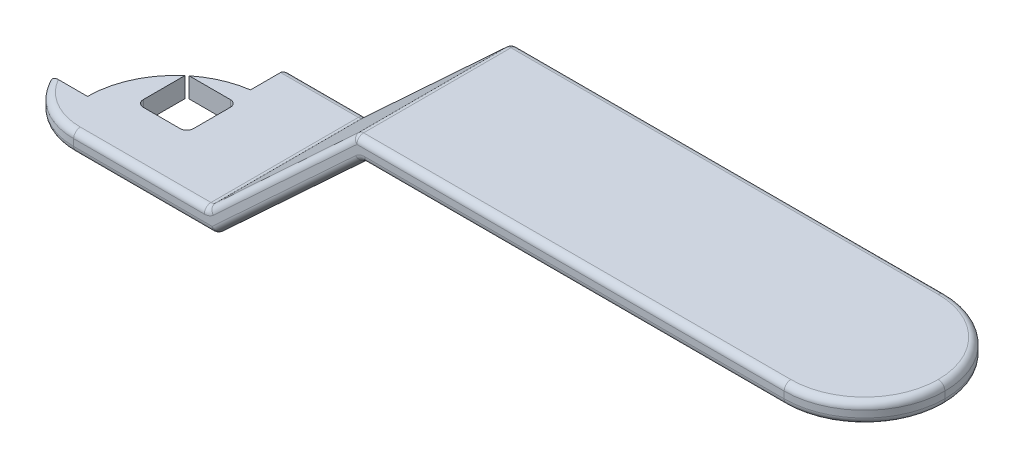
from build123d import *

# Parameters (mm, degrees)
EXTRUDE_THIN1_DEPTH = 24
CUT_EXTRUDE1_DEPTH  = 131.847239176
FILLET1_R           = 10
FILLET2_R           = 12
FILLET3_R           = 1
FILLET4_R           = 1


# Some blends are built 0.0001 mm under size
with BuildPart() as part:
    # Sketch1 → Extrude-Thin1 (new body)
    with BuildSketch(Plane.XY):
        Polygon((0, 0), (30, 0), (52, 20.396078054), (127, 20.396078054), (127, 23.396078054), (50.823303189, 23.396078054), (28.823303189, 3), (0, 3), align=None)
    extrude(amount=-EXTRUDE_THIN1_DEPTH)

    # Sketch2 → Cut-Extrude1 (cut, through all)
    with BuildSketch(Plane(origin=(0, 3, 0), x_dir=(1, 0, 0), z_dir=(0, 1, 0))):
        with BuildLine():
            Line((16.823303189, 24), (0, 24))
            Line((0, 24), (0, 5.5))
            Line((0, 5.5), (5.5, 5.5))
            ThreePointArc((5.5, 5.5), (6.698004209, 10.97816866), (10.073303189, 15.456215417))
            Line((10.073303189, 15.456215417), (10.073303189, 8.25))
            Line((10.073303189, 8.25), (17.573303189, 8.25))
            Line((17.573303189, 8.25), (17.573303189, 15.75))
            Line((17.573303189, 15.75), (10.427766753, 15.75))
            ThreePointArc((10.427766753, 15.75), (13.439867838, 17.556796696), (16.823303189, 18.5))
            Line((16.823303189, 18.5), (16.823303189, 24))
        make_face()
    extrude(amount=-CUT_EXTRUDE1_DEPTH, mode=Mode.SUBTRACT)

    # Fillet1
    # the kernel refuses this fillet: 10 mm, written as the material it takes off along each edge
    with BuildSketch(Plane(origin=(0, 25.325713874, 0), x_dir=(1, 0, 0), z_dir=(0, -1, 0))) as fillet1_piece_1:
        with BuildLine():
            CenterArc((8.93028555, -10), FILLET1_R, 90, 63.25631605)
            Line((0, -5.5), (-0.178605711, -5.41))
            ThreePointArc((-0.178605711, -5.41), (-0.2, -2.75), (-0.2, 0))
            Line((-0.2, 0), (0, 0.2))
            Line((0, 0.2), (8.93028555, 0.2))
            Line((8.93028555, 0.2), (8.93028555, 0))
        make_face()
    extrude(amount=47.651427749, mode=Mode.SUBTRACT)

    # Fillet2
    fillet2_edges = [part.edges().sort_by_distance(p)[0] for p in [
        (127, 21.896078054, 0),
        (127, 21.896078054, -24),
    ]]
    fillet(fillet2_edges, radius=FILLET2_R - 0.0001)  # a hair under: the kernel refuses the full size

    # Fillet3
    fillet3_edges = [part.edges().sort_by_distance(p)[0] for p in [
        (52, 20.396078054, -12),
        (30, 0, -12),
        (28.823303189, 3, -12),
        (50.823303189, 23.396078054, -12),
        (82.911701595, 23.396078054, -24),
        (39.823303189, 13.198039027, -24),
        (23.411651595, 0, -24),
        (22.823303189, 3, -24),
        (16.823303189, 1.5, -24),
        (41, 10.198039027, -24),
        (83.50005, 20.396078054, -24),
        (18.876794369, 3, 0),
        (3.686241309, 3, -1.485306817),
        (19.465142775, 0, 0),
        (3.686241309, 0, -1.485306817),
        (123.485310664, 20.396078054, -20.485310664),
        (123.485310664, 20.396078054, -3.514689336),
        (123.485310664, 23.396078054, -20.485310664),
        (123.485310664, 23.396078054, -3.514689336),
        (41, 10.198039027, 0),
        (39.823303189, 13.198039027, 0),
        (82.911701595, 23.396078054, 0),
        (83.50005, 20.396078054, 0),
    ]]
    fillet(fillet3_edges, radius=FILLET3_R)

    # Fillet4
    fillet4_edges = [part.edges().sort_by_distance(p)[0] for p in [
        (17.573303189, 1.5, -15.75),
        (17.573303189, 1.5, -8.25),
        (10.073303189, 1.5, -8.25),
    ]]
    fillet(fillet4_edges, radius=FILLET4_R)


solid = part.part
